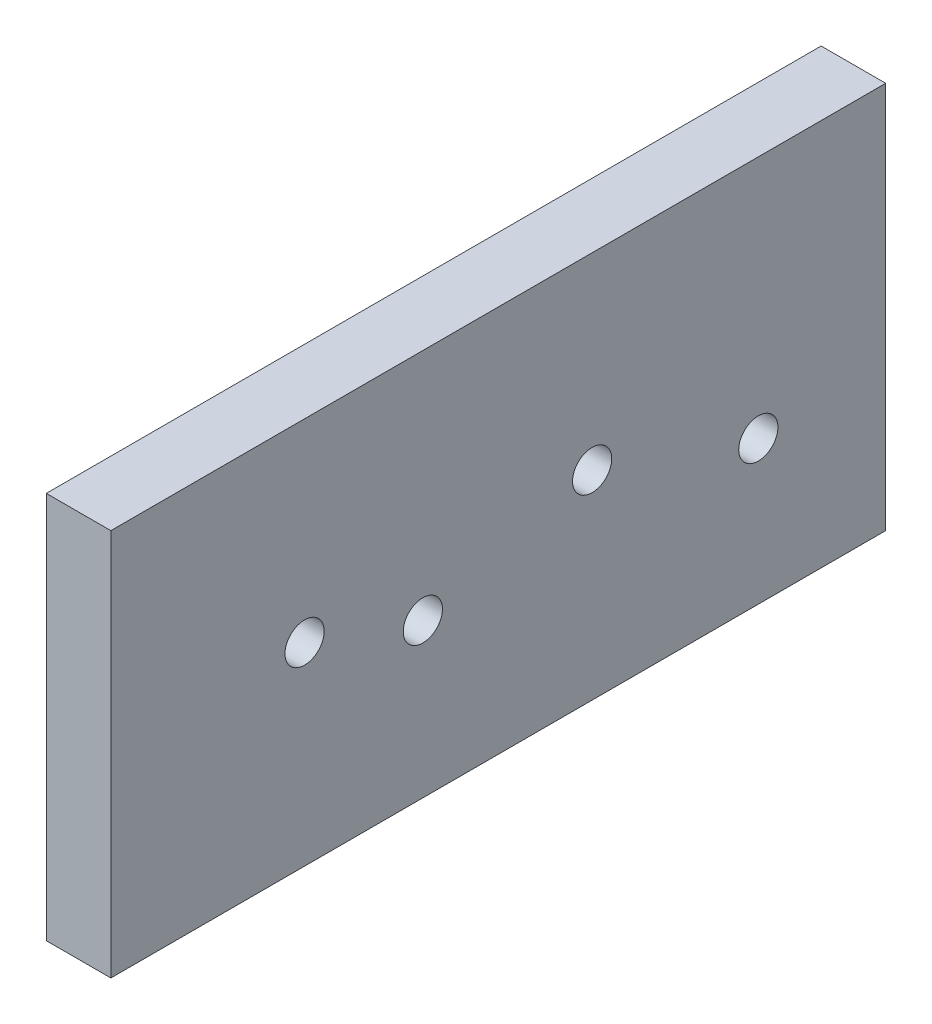
from build123d import *

# Parameters (mm, degrees)
SKETCH1_W                       = 152.4
SKETCH1_H                       = 76.2
SKETCH1_R                       = 3.854557775
BOSS_EXTRUDE1_DEPTH             = 12.7
F_1_4_0_25_DIAMETER_HOLE2_D     = 6.35
F_1_4_0_25_DIAMETER_HOLE2_DEPTH = 38.1
F_1_4_0_25_DIAMETER_HOLE2_TIP   = 1.907732465
SKETCH2_R                       = 6.1595
CUT_EXTRUDE1_DEPTH              = 4.7625


with BuildPart() as part:
    # Sketch1 → Boss-Extrude1 (new body)
    with BuildSketch(Plane(origin=(0, 0, 0), x_dir=(0, 0, -1), z_dir=(1, 0, 0))):
        Rectangle(SKETCH1_W, SKETCH1_H)
        with Locations((18.457733582, 1.096077429)):
            Circle(SKETCH1_R, mode=Mode.SUBTRACT)
        with Locations((-38.1, 0)):
            Circle(SKETCH1_R, mode=Mode.SUBTRACT)
        with Locations((-14.836022013, -7.860160654)):
            Circle(SKETCH1_R, mode=Mode.SUBTRACT)
        with Locations((51.143457994, -9.873506971)):
            Circle(SKETCH1_R, mode=Mode.SUBTRACT)
    extrude(amount=BOSS_EXTRUDE1_DEPTH)

    # 1/4 (0.25) Diameter Hole2
    with Locations(Plane.XZ.offset(38.1)):
        with Locations((6.35, 57.15), (6.35, -63.5), (6.35, 0)):
            Hole(F_1_4_0_25_DIAMETER_HOLE2_D / 2, depth=F_1_4_0_25_DIAMETER_HOLE2_DEPTH)
            with Locations((0, 0, -(F_1_4_0_25_DIAMETER_HOLE2_DEPTH + F_1_4_0_25_DIAMETER_HOLE2_TIP / 2))):  # 118° drill point
                Cone(0, F_1_4_0_25_DIAMETER_HOLE2_D / 2, F_1_4_0_25_DIAMETER_HOLE2_TIP, mode=Mode.SUBTRACT)

    # Sketch2 → Cut-Extrude1 (cut)
    with BuildSketch(Plane.ZY):
        with Locations((38.1, 0)):
            Circle(SKETCH2_R)
        with Locations((14.836022013, -7.860160654)):
            Circle(SKETCH2_R)
        with Locations((-18.457733582, 1.096077429)):
            Circle(SKETCH2_R)
        with Locations((-51.143457994, -9.873506971)):
            Circle(SKETCH2_R)
    extrude(amount=-CUT_EXTRUDE1_DEPTH, mode=Mode.SUBTRACT)


solid = part.part
